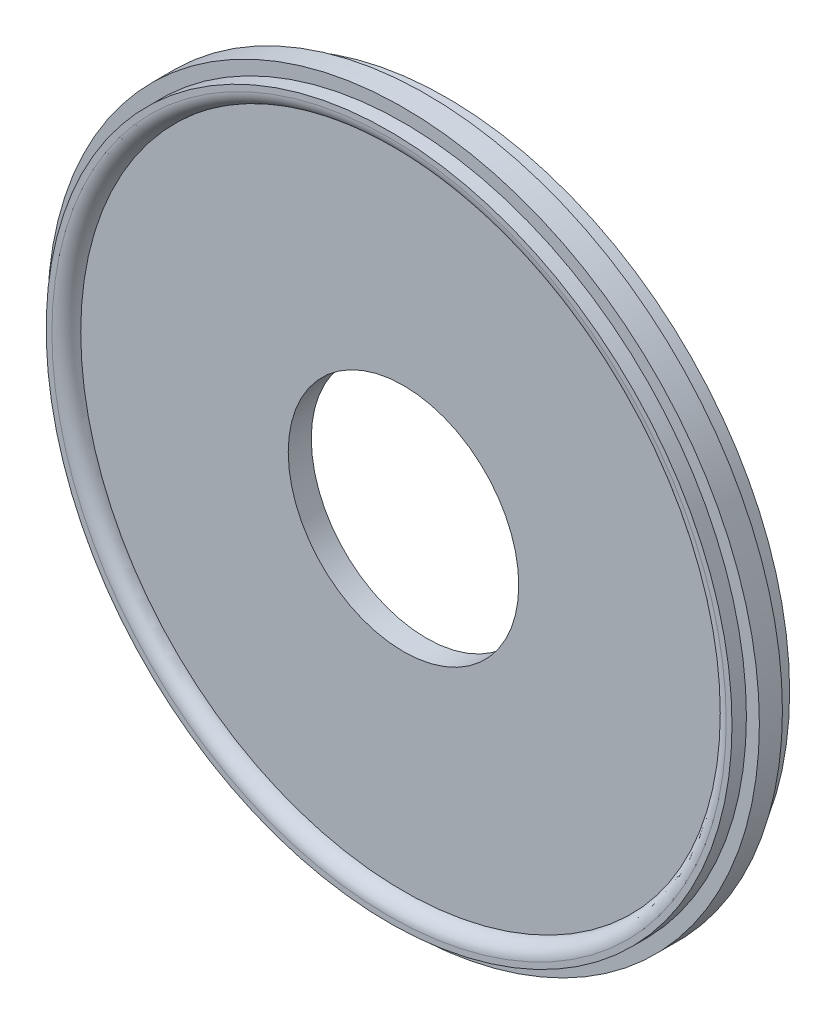
from build123d import *

# Parameters (mm, degrees)
SKETCH1_R           = 59.5
SKETCH1_R_2         = 52
BOSS_EXTRUDE1_DEPTH = 3.5
SKETCH2_R           = 61.75
BOSS_EXTRUDE2_DEPTH = 4
SKETCH3_R           = 59.5
SKETCH3_R_2         = 56
BOSS_EXTRUDE3_DEPTH = 2.5
FILLET1_R           = 2.5
SKETCH4_R           = 20
CUT_EXTRUDE1_DEPTH  = 22.5


with BuildPart() as part:
    # Sketch1 → Boss-Extrude1 (new body)
    with BuildSketch(Plane.XY):
        Circle(SKETCH1_R)
        Circle(SKETCH1_R_2, mode=Mode.SUBTRACT)
    extrude(amount=BOSS_EXTRUDE1_DEPTH)

    # Sketch2 → Boss-Extrude2 (add)
    with BuildSketch(Plane.XY.offset(3.5)):
        Circle(SKETCH2_R)
    extrude(amount=BOSS_EXTRUDE2_DEPTH)

    # Sketch3 → Boss-Extrude3 (add)
    with BuildSketch(Plane.XY.offset(7.5)):
        Circle(SKETCH3_R)
        Circle(SKETCH3_R_2, mode=Mode.SUBTRACT)
    extrude(amount=BOSS_EXTRUDE3_DEPTH)

    # Fillet1
    fillet1_edges = [part.edges().sort_by_distance(p)[0] for p in [
        (-56, 0, 10),
    ]]
    fillet(fillet1_edges, radius=FILLET1_R - 0.0001)  # a hair under: the kernel refuses the full size

    # Sketch4 → Cut-Extrude1 (cut)
    with BuildSketch(Plane.XY.offset(7.5)):
        Circle(SKETCH4_R)
    extrude(amount=-CUT_EXTRUDE1_DEPTH, mode=Mode.SUBTRACT)


solid = part.part
